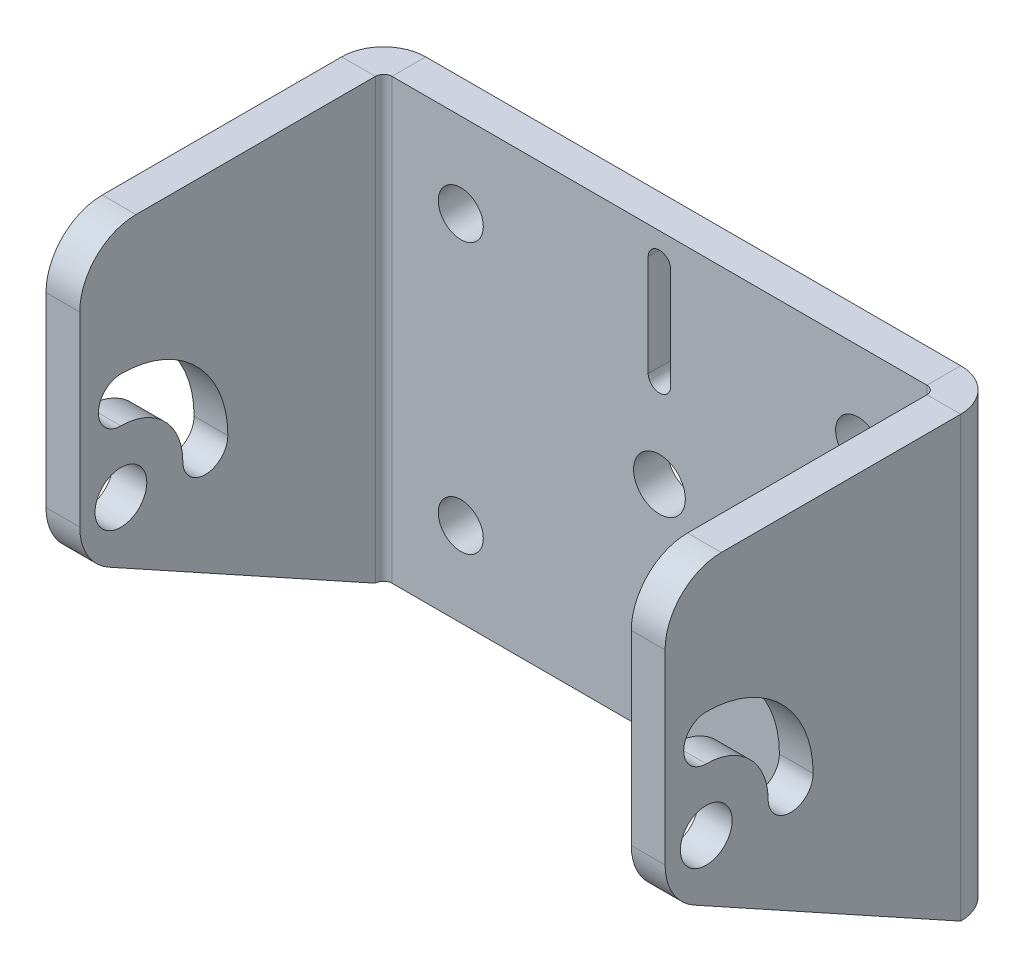
from build123d import *

# Parameters (mm, degrees)
ESBO_O1_W                        = 49
ESBO_O1_H                        = 39
FLANGE_BASE1_DEPTH               = 3
ESBO_O6_R                        = 2.3
CORTE_EXTRUS_O1_DEPTH            = 10
ARESTA_FLANGE1_STRIP_W           = 13.4732
ARESTA_FLANGE1_STRIP_H           = 3
ARESTA_FLANGE1_STRIP_CUT_DEPTH   = 39
ARESTA_FLANGE1_STRIP_2_W         = 13.4732
ARESTA_FLANGE1_STRIP_2_H         = 3
ARESTA_FLANGE1_STRIP_CUT_2_DEPTH = 39
ARESTA_FLANGE1_DEPTH             = 39
ARESTA_FLANGE1_BEND_DEPTH        = 39
ESBO_O13_R                       = 2.3
CORTE_EXTRUS_O2_DEPTH            = 70
FILETE1_R                        = 5


# Sheet-metal steps are written as plain solids
with BuildPart() as part:
    # Esboço1 → Flange-base1 (new body)
    with BuildSketch(Plane.XY):
        with Locations((2.493735783, -4.490936556)):
            Rectangle(ESBO_O1_W, ESBO_O1_H)
    extrude(amount=-FLANGE_BASE1_DEPTH)

    # Esboço6 → Corte-extrusão1 (cut)
    with BuildSketch(Plane.XY):
        with BuildLine():
            Line((-15.156264217, 5.509063444), (-15.156264217, 7.509063444))
            Line((-15.156264217, 7.509063444), (-13.156264217, 7.509063444))
            ThreePointArc((-13.156264217, 7.509063444), (-16.570477779, 8.923277006), (-15.156264217, 5.509063444))
        make_face()
        with BuildLine():
            Line((-13.156264217, 7.509063444), (-15.156264217, 7.509063444))
            Line((-15.156264217, 7.509063444), (-15.156264217, 5.509063444))
            ThreePointArc((-15.156264217, 5.509063444), (-13.742050654, 6.094849882), (-13.156264217, 7.509063444))
        make_face()
        with BuildLine():
            ThreePointArc((-13.156264217, -16.490936556), (-13.742050654, -15.076722994), (-15.156264217, -14.490936556))
            Line((-15.156264217, -14.490936556), (-15.156264217, -16.490936556))
            Line((-15.156264217, -16.490936556), (-13.156264217, -16.490936556))
        make_face()
        with BuildLine():
            Line((-15.156264217, -16.490936556), (-15.156264217, -14.490936556))
            ThreePointArc((-15.156264217, -14.490936556), (-16.570477779, -17.905150118), (-13.156264217, -16.490936556))
            Line((-13.156264217, -16.490936556), (-15.156264217, -16.490936556))
        make_face()
        with Locations((2.493735783, -4.490936556)):
            Circle(ESBO_O6_R)
        with BuildLine():
            Line((3.493735783, 7.509063444), (1.493735783, 7.509063444))
            Line((1.493735783, 7.509063444), (1.493735783, 3.523823043))
            ThreePointArc((1.493735783, 3.523823043), (2.493735783, 2.523823043), (3.493735783, 3.523823043))
            Line((3.493735783, 3.523823043), (3.493735783, 7.509063444))
        make_face()
        with BuildLine():
            Line((1.493735783, 12.523823043), (1.493735783, 7.509063444))
            Line((1.493735783, 7.509063444), (3.493735783, 7.509063444))
            Line((3.493735783, 7.509063444), (3.493735783, 12.523823043))
            ThreePointArc((3.493735783, 12.523823043), (2.493735783, 13.523823043), (1.493735783, 12.523823043))
        make_face()
        with BuildLine():
            Line((1.493735783, -12.505696155), (1.493735783, -16.490936556))
            Line((1.493735783, -16.490936556), (3.493735783, -16.490936556))
            Line((3.493735783, -16.490936556), (3.493735783, -12.505696155))
            ThreePointArc((3.493735783, -12.505696155), (2.493735783, -11.505696155), (1.493735783, -12.505696155))
        make_face()
        with BuildLine():
            Line((3.493735783, -16.490936556), (1.493735783, -16.490936556))
            Line((1.493735783, -16.490936556), (1.493735783, -21.505696155))
            ThreePointArc((1.493735783, -21.505696155), (2.493735783, -22.505696155), (3.493735783, -21.505696155))
            Line((3.493735783, -21.505696155), (3.493735783, -16.490936556))
        make_face()
        with BuildLine():
            ThreePointArc((22.143735783, -16.490936556), (21.557949346, -15.076722994), (20.143735783, -14.490936556))
            Line((20.143735783, -14.490936556), (20.143735783, -16.490936556))
            Line((20.143735783, -16.490936556), (18.143735783, -16.490936556))
            ThreePointArc((18.143735783, -16.490936556), (20.143735783, -18.490936556), (22.143735783, -16.490936556))
        make_face()
        with BuildLine():
            Line((20.143735783, -16.490936556), (20.143735783, -14.490936556))
            ThreePointArc((20.143735783, -14.490936556), (18.729522221, -15.076722994), (18.143735783, -16.490936556))
            Line((18.143735783, -16.490936556), (20.143735783, -16.490936556))
        make_face()
        with BuildLine():
            ThreePointArc((22.143735783, 7.509063444), (20.143735783, 9.509063444), (18.143735783, 7.509063444))
            Line((18.143735783, 7.509063444), (20.143735783, 7.509063444))
            Line((20.143735783, 7.509063444), (20.143735783, 5.509063444))
            ThreePointArc((20.143735783, 5.509063444), (21.557949346, 6.094849882), (22.143735783, 7.509063444))
        make_face()
        with BuildLine():
            Line((20.143735783, 7.509063444), (18.143735783, 7.509063444))
            ThreePointArc((18.143735783, 7.509063444), (18.729522221, 6.094849882), (20.143735783, 5.509063444))
            Line((20.143735783, 5.509063444), (20.143735783, 7.509063444))
        make_face()
    extrude(amount=-CORTE_EXTRUS_O1_DEPTH, mode=Mode.SUBTRACT)

    # Aresta-Flange1 strip (across the edge) → Aresta-Flange1 strip cut (cut)
    with BuildSketch(Plane(origin=(26.993735783, -23.990936556, 0), x_dir=(-1, 0, 0), z_dir=(0, 1, 0))):
        with Locations((-6, -1.5)):
            Rectangle(ARESTA_FLANGE1_STRIP_W, ARESTA_FLANGE1_STRIP_H)
    extrude(amount=ARESTA_FLANGE1_STRIP_CUT_DEPTH, mode=Mode.SUBTRACT)

    # Aresta-Flange1 strip 2 (across the edge) → Aresta-Flange1 strip cut 2 (cut)
    with BuildSketch(Plane(origin=(-22.006264217, 15.009063444, 0), x_dir=(1, 0, 0), z_dir=(0, -1, 0))):
        with Locations((-6, -1.5)):
            Rectangle(ARESTA_FLANGE1_STRIP_2_W, ARESTA_FLANGE1_STRIP_2_H)
    extrude(amount=ARESTA_FLANGE1_STRIP_CUT_2_DEPTH, mode=Mode.SUBTRACT)

    # Aresta-Flange1 section (across the edge) → Aresta-Flange1 (add)
    with BuildSketch(Plane(origin=(26.993735783, -23.990936556, 0), x_dir=(-1, 0, 0), z_dir=(0, 1, 0))):
        with BuildLine():
            Line((-3, 0.7366), (-3, 27))
            Line((-3, 27), (0, 27))
            Line((0, 27), (0, 0.7366))
            ThreePointArc((0, 0.7366), (0.215745145, 0.215745145), (0.7366, 0))
            Line((0.7366, 0), (0.7366, -3))
            ThreePointArc((0.7366, -3), (-1.905575199, -1.905575199), (-3, 0.7366))
        make_face()
    extrude(amount=ARESTA_FLANGE1_DEPTH)

    # Aresta-Flange1 section 2 (across the edge) → Aresta-Flange1 bend (add)
    with BuildSketch(Plane(origin=(-22.006264217, 15.009063444, 0), x_dir=(1, 0, 0), z_dir=(0, -1, 0))):
        with BuildLine():
            Line((-3, 0.7366), (-3, 27))
            Line((-3, 27), (0, 27))
            Line((0, 27), (0, 0.7366))
            ThreePointArc((0, 0.7366), (0.215745145, 0.215745145), (0.7366, 0))
            Line((0.7366, 0), (0.7366, -3))
            ThreePointArc((0.7366, -3), (-1.905575199, -1.905575199), (-3, 0.7366))
        make_face()
    extrude(amount=ARESTA_FLANGE1_BEND_DEPTH)

    # Esboço13 → Corte-extrusão2 (cut)
    with BuildSketch(Plane.ZY.offset(25.006264217)):
        with Locations((23.343855314, -6.08027591)):
            Circle(ESBO_O13_R)
        Polygon((0.7366, -23.990936556), (27, -23.990936556), (27, -9.490936556), align=None)
        with BuildLine():
            ThreePointArc((23.343855314, 3.41972409), (16.626340893, 0.637238511), (13.843855314, -6.08027591))
            ThreePointArc((13.843855314, -6.08027591), (15.843855314, -8.08027591), (17.843855314, -6.08027591))
            ThreePointArc((17.843855314, -6.08027591), (19.454768018, -2.191188614), (23.343855314, -0.58027591))
            ThreePointArc((23.343855314, -0.58027591), (25.343855314, 1.41972409), (23.343855314, 3.41972409))
        make_face()
    extrude(amount=-CORTE_EXTRUS_O2_DEPTH, mode=Mode.SUBTRACT)

    # Filete1
    filete1_edges = [part.edges().sort_by_distance(p)[0] for p in [
        (28.493735783, 15.009063444, 27),
        (-23.506264217, 15.009063444, 27),
        (-23.506264217, -9.490936556, 27),
        (28.493735783, -9.490936556, 27),
    ]]
    fillet(filete1_edges, radius=FILETE1_R)


solid = part.part
